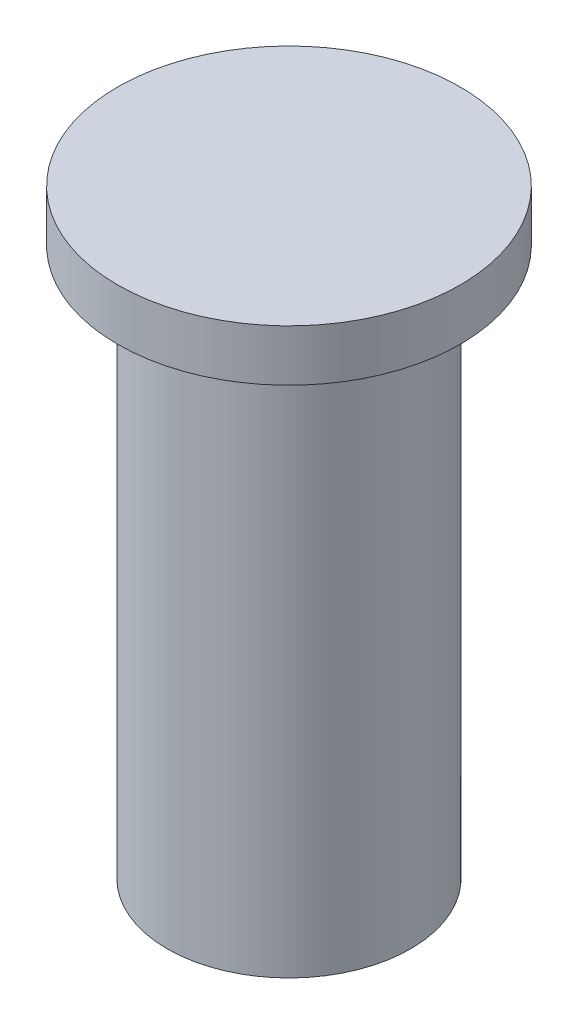
from build123d import *

# Parameters (mm, degrees)
SKETCH1_R           = 3.55
BOSS_EXTRUDE1_DEPTH = 16
SKETCH2_R           = 5
BOSS_EXTRUDE2_DEPTH = 1.5


with BuildPart() as part:
    # Sketch1 → Boss-Extrude1 (new body)
    with BuildSketch(Plane(origin=(0, 0, 0), x_dir=(1, 0, 0), z_dir=(0, 1, 0))):
        Circle(SKETCH1_R)
    extrude(amount=BOSS_EXTRUDE1_DEPTH)

    # Sketch2 → Boss-Extrude2 (add)
    with BuildSketch(Plane(origin=(0, 16, 0), x_dir=(1, 0, 0), z_dir=(0, 1, 0))):
        Circle(SKETCH2_R)
    extrude(amount=BOSS_EXTRUDE2_DEPTH)


solid = part.part
